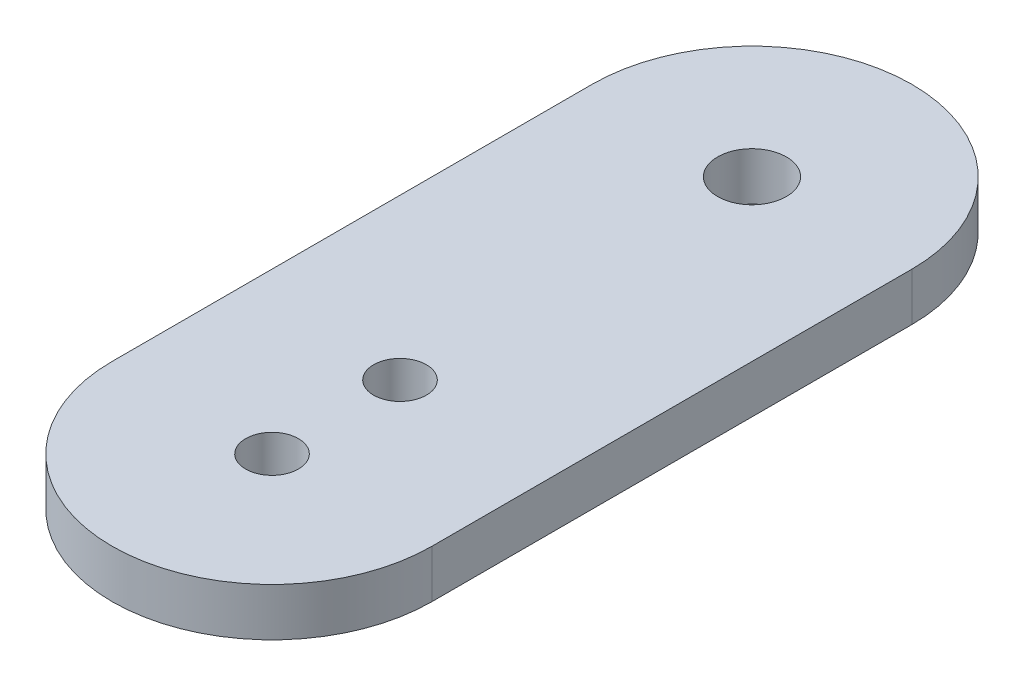
from build123d import *

# Parameters (mm, degrees)
BOSS_EXTRUDE1_DEPTH = 3
SKETCH3_R           = 1.65
SKETCH3_R_2         = 2.15
CUT_EXTRUDE1_DEPTH  = 3
CUT_EXTRUDE2_DEPTH  = 0.1


with BuildPart() as part:
    # Sketch2 → Boss-Extrude1 (new body)
    with BuildSketch(Plane(origin=(0, 0, 0), x_dir=(1, 0, 0), z_dir=(0, 1, 0))):
        with BuildLine():
            Line((-10, 0), (-10, 30))
            ThreePointArc((-10, 30), (0, 40), (10, 30))
            Line((10, 30), (10, 0))
            ThreePointArc((10, 0), (0, -10), (-10, 0))
        make_face()
    extrude(amount=BOSS_EXTRUDE1_DEPTH)

    # Sketch3 → Cut-Extrude1 (cut)
    with BuildSketch(Plane(origin=(0, 3, 0), x_dir=(1, 0, 0), z_dir=(0, 1, 0))):
        Circle(SKETCH3_R)
        with Locations((0, 8)):
            Circle(SKETCH3_R)
        with Locations((0, 30)):
            Circle(SKETCH3_R_2)
    extrude(amount=-CUT_EXTRUDE1_DEPTH, mode=Mode.SUBTRACT)

    # Sketch4 → Cut-Extrude2 (cut)
    # profile 1 of 6: a face of its own
    with BuildSketch(Plane.XZ):
        with BuildLine():
            Line((-3.984014423, -17.192190903), (-4.1671875, -17.365823716))
            add(Edge.make_bspline(
                [(-4.1671875, -17.365823716), (-4.200333744, -17.334642361), (-4.265835839, -17.273023188), (-4.372624862, -17.193073743), (-4.48404262, -17.124584843), (-4.599507729, -17.06885935), (-4.716160781, -17.024396132), (-4.832453395, -16.99274038), (-4.947192703, -16.972552457), (-5.023506471, -16.970138299), (-5.061110276, -16.968948716)],
                knots=[0, 0, 0, 0, 1.08915593, 2.152340314, 3.188132944, 4.216796309, 5.218260357, 6.173443236, 7.099959455, 8, 8, 8, 8], degree=3))
            add(Edge.make_bspline(
                [(-5.061110276, -16.968948716), (-5.084184385, -16.969230116), (-5.130272758, -16.969792185), (-5.198731616, -16.976966017), (-5.266472489, -16.987283541), (-5.333367499, -17.002211854), (-5.399546714, -17.021131946), (-5.464779964, -17.044798485), (-5.529188935, -17.072390535), (-5.59216693, -17.104273754), (-5.653222522, -17.139298435), (-5.710887441, -17.178111817), (-5.765529235, -17.219469904), (-5.816120882, -17.26440816), (-5.862953393, -17.312519524), (-5.907141482, -17.362909023), (-5.947131035, -17.416953341), (-5.983251988, -17.473658133), (-6.015474803, -17.532027462), (-6.043919619, -17.591499514), (-6.067798174, -17.651877029), (-6.086691321, -17.713235771), (-6.102278748, -17.775101048), (-6.113244477, -17.837901224), (-6.119426694, -17.901703542), (-6.120496066, -17.944428105), (-6.121033654, -17.965906348)],
                knots=[0, 0, 0, 0, 1.02818874, 2.053710826, 3.065248034, 4.081641283, 5.106893873, 6.131558223, 7.173050175, 8.228653731, 9.27666206, 10.308777013, 11.325269123, 12.329503258, 13.32196095, 14.316845687, 15.314881793, 16.315733098, 17.311955233, 18.285320748, 19.252783886, 20.203351036, 21.145449891, 22.095197417, 23.042428769, 24, 24, 24, 24], degree=3))
            add(Edge.make_bspline(
                [(-6.121033654, -17.965906348), (-6.120519496, -17.987862029), (-6.119492583, -18.031713437), (-6.112920115, -18.097159762), (-6.100722509, -18.16163408), (-6.084415907, -18.225348256), (-6.064018245, -18.288411409), (-6.038591485, -18.350550135), (-6.008475067, -18.411762133), (-5.973615913, -18.471495869), (-5.935389228, -18.529682068), (-5.892565453, -18.584491315), (-5.847076378, -18.636653465), (-5.797264778, -18.685010368), (-5.744727911, -18.730855483), (-5.68789613, -18.772925723), (-5.627886956, -18.812031442), (-5.564608835, -18.847679788), (-5.498748371, -18.87952631), (-5.43121833, -18.907845425), (-5.361802977, -18.931167617), (-5.290867111, -18.950175506), (-5.218495296, -18.965755887), (-5.144320173, -18.975779235), (-5.068887134, -18.983052818), (-5.018038172, -18.983584633), (-4.992420373, -18.983852562)],
                knots=[0, 0, 0, 0, 0.93586088, 1.869166235, 2.799637598, 3.729985548, 4.670839027, 5.622275134, 6.589130586, 7.576015415, 8.568469353, 9.55398029, 10.53834874, 11.515998671, 12.510579167, 13.508179873, 14.527009472, 15.561807829, 16.601455013, 17.643573243, 18.680854198, 19.719860599, 20.772568776, 21.833555941, 22.908541556, 24, 24, 24, 24], degree=3))
            add(Edge.make_bspline(
                [(-4.992420373, -18.983852562), (-4.96154689, -18.983207191), (-4.900921791, -18.981939901), (-4.811804229, -18.972074526), (-4.726213211, -18.956666618), (-4.644389241, -18.934101963), (-4.566237282, -18.905320356), (-4.491470834, -18.87062528), (-4.420678545, -18.828685985), (-4.3536476, -18.781350907), (-4.291900301, -18.728613137), (-4.236210263, -18.671705035), (-4.187465743, -18.610902832), (-4.144940224, -18.546564645), (-4.109759872, -18.478157928), (-4.080883613, -18.406017917), (-4.058749355, -18.330112163), (-4.049663203, -18.277662321), (-4.045072115, -18.251160254)],
                knots=[0, 0, 0, 0, 1.13008108, 2.219097802, 3.278683437, 4.311054135, 5.322181354, 6.324827112, 7.324222904, 8.330512327, 9.32562643, 10.293043162, 11.24128371, 12.174520618, 13.111833804, 14.052305215, 15.015860969, 16, 16, 16, 16], degree=3))
            Line((-4.045072115, -18.251160254), (-4.838822115, -18.251160254))
            Line((-4.838822115, -18.251160254), (-4.838822115, -18.006929485))
            Line((-4.838822115, -18.006929485), (-3.831370192, -18.006929485))
            add(Edge.make_bspline(
                [(-3.831370192, -18.006929485), (-3.832530778, -18.052450473), (-3.834802255, -18.141543269), (-3.850735482, -18.271471257), (-3.876464216, -18.394188427), (-3.911611678, -18.509824017), (-3.957110753, -18.618214158), (-4.012473134, -18.719468899), (-4.07858488, -18.812934105), (-4.153091091, -18.899372802), (-4.236706956, -18.976477141), (-4.327173106, -19.044244752), (-4.424639008, -19.101328496), (-4.529012466, -19.147770125), (-4.639951797, -19.184015468), (-4.757713712, -19.20971363), (-4.882138515, -19.225110087), (-4.967412219, -19.227077258), (-5.011023888, -19.228083331)],
                knots=[0, 0, 0, 0, 1.140356446, 2.231883559, 3.274166699, 4.278491846, 5.25512956, 6.21435461, 7.1637429, 8.11826594, 9.068280886, 10.0076534, 10.945064095, 11.891975133, 12.864533718, 13.863980011, 14.907571808, 16, 16, 16, 16], degree=3))
            add(Edge.make_bspline(
                [(-5.011023888, -19.228083331), (-5.037904891, -19.227696126), (-5.090922892, -19.226932431), (-5.169225827, -19.221504986), (-5.24536978, -19.213149808), (-5.319343657, -19.200532501), (-5.391419565, -19.185078424), (-5.461237533, -19.165289067), (-5.529063521, -19.142382327), (-5.595002365, -19.116327592), (-5.658455566, -19.086139018), (-5.71970575, -19.052590853), (-5.779091489, -19.015856084), (-5.836208264, -18.975299419), (-5.891353674, -18.93122421), (-5.944172142, -18.883542115), (-5.994959359, -18.832398907), (-6.026773174, -18.796082116), (-6.042803486, -18.77778285)],
                knots=[0, 0, 0, 0, 1.107784379, 2.184907829, 3.233506516, 4.263428166, 5.276301166, 6.270063455, 7.25232949, 8.225834625, 9.190232166, 10.146266622, 11.1027726, 12.066435141, 13.031522626, 14.010570082, 14.99756817, 16, 16, 16, 16], degree=3))
            add(Edge.make_bspline(
                [(-6.042803486, -18.77778285), (-6.066062129, -18.748751567), (-6.112193345, -18.691170889), (-6.171573662, -18.598914498), (-6.222193188, -18.50339109), (-6.263264867, -18.404334745), (-6.295335601, -18.301838116), (-6.318335926, -18.196032177), (-6.331811957, -18.086780678), (-6.333753382, -18.012849489), (-6.334735577, -17.975446612)],
                knots=[0, 0, 0, 0, 1.023165419, 2.029347347, 3.013907458, 3.994755782, 4.975994455, 5.96558838, 6.970761222, 8, 8, 8, 8], degree=3))
            add(Edge.make_bspline(
                [(-6.334735577, -17.975446612), (-6.334373465, -17.947438858), (-6.333653843, -17.891779312), (-6.324927912, -17.809144965), (-6.312408375, -17.727977887), (-6.294006719, -17.648344426), (-6.270809081, -17.570191399), (-6.241857513, -17.493482516), (-6.208149289, -17.418172511), (-6.168970586, -17.344779754), (-6.125370266, -17.274278145), (-6.078051277, -17.206951496), (-6.026341684, -17.1440259), (-5.971085935, -17.08470444), (-5.911624769, -17.029732367), (-5.848515232, -16.978600731), (-5.78170869, -16.931240944), (-5.710994967, -16.888398967), (-5.637429525, -16.849915504), (-5.561188703, -16.816177129), (-5.482295774, -16.788293838), (-5.401341793, -16.764635249), (-5.317713994, -16.747139769), (-5.232019245, -16.734451962), (-5.143810865, -16.725770197), (-5.084187066, -16.725071976), (-5.053955078, -16.724717947)],
                knots=[0, 0, 0, 0, 1.008945113, 2.00506715, 2.99143336, 3.967273523, 4.948097931, 5.927297278, 6.919902385, 7.919676788, 8.923139349, 9.905703106, 10.883022732, 11.856032218, 12.825136022, 13.798837087, 14.781400844, 15.773989409, 16.776158564, 17.77167057, 18.775803737, 19.789618931, 20.80898985, 21.851988756, 22.910860228, 24, 24, 24, 24], degree=3))
            add(Edge.make_bspline(
                [(-5.053955078, -16.724717947), (-5.02930013, -16.725112208), (-4.980412266, -16.725893982), (-4.90766458, -16.731312787), (-4.836041333, -16.739901535), (-4.765436324, -16.751621902), (-4.696089993, -16.767585592), (-4.627804788, -16.786688853), (-4.560481723, -16.808930968), (-4.49433179, -16.835457308), (-4.428910201, -16.865565578), (-4.363853198, -16.899456496), (-4.299383069, -16.937709579), (-4.235388008, -16.980438413), (-4.171464469, -17.026909131), (-4.108623525, -17.078450827), (-4.045348307, -17.133030952), (-4.004661716, -17.172275438), (-3.984014423, -17.192190903)],
                knots=[0, 0, 0, 0, 0.985871117, 1.954866573, 2.915460327, 3.869826059, 4.81536089, 5.759505086, 6.70452669, 7.649098992, 8.607881297, 9.583363685, 10.581137262, 11.603961102, 12.659522466, 13.73993555, 14.853081303, 16, 16, 16, 16], degree=3))
        make_face()
    # profile 2 of 6: a face of its own
    with BuildSketch(Plane.XZ):
        with BuildLine():
            Line((-3.465024038, -17.426881408), (-3.251322115, -17.426881408))
            Line((-3.251322115, -17.426881408), (-3.251322115, -17.683037508))
            add(Edge.make_bspline(
                [(-3.251322115, -17.683037508), (-3.235545478, -17.659187025), (-3.205372781, -17.613573161), (-3.155221663, -17.553246369), (-3.103852432, -17.503297917), (-3.051019171, -17.46349463), (-2.996333356, -17.433686062), (-2.94099518, -17.411851336), (-2.884134012, -17.398939984), (-2.845923846, -17.397216191), (-2.826780349, -17.396352562)],
                knots=[0, 0, 0, 0, 1.2804753, 2.448899062, 3.506932113, 4.484331642, 5.4025378, 6.288909075, 7.142734305, 8, 8, 8, 8], degree=3))
            add(Edge.make_bspline(
                [(-2.826780349, -17.396352562), (-2.811930651, -17.397162545), (-2.781376435, -17.398829138), (-2.735123994, -17.410538646), (-2.687469431, -17.429233515), (-2.656756486, -17.446814095), (-2.640745192, -17.455979215)],
                knots=[0, 0, 0, 0, 0.901110191, 1.854092781, 2.881294221, 4, 4, 4, 4], degree=3))
            Line((-2.640745192, -17.455979215), (-2.758090445, -17.641060344))
            add(Edge.make_bspline(
                [(-2.758090445, -17.641060344), (-2.768369975, -17.636474556), (-2.787882492, -17.627769852), (-2.816426581, -17.617467878), (-2.842743704, -17.611401871), (-2.859510125, -17.6104829), (-2.867326472, -17.610054485)],
                knots=[0, 0, 0, 0, 1.180555205, 2.24091978, 3.179933427, 4, 4, 4, 4], degree=3))
            add(Edge.make_bspline(
                [(-2.867326472, -17.610054485), (-2.884475373, -17.611197511), (-2.91945416, -17.613528951), (-2.970810578, -17.631856961), (-3.020644838, -17.661469669), (-3.060222344, -17.694311265), (-3.090867162, -17.725980392), (-3.112733994, -17.753635823), (-3.132792792, -17.78464557), (-3.151958602, -17.818479516), (-3.169420849, -17.855715357), (-3.185718579, -17.895981079), (-3.200454341, -17.939323319), (-3.208856918, -17.969519283), (-3.213161058, -17.984986877)],
                knots=[0, 0, 0, 0, 1.125678352, 2.296057538, 3.5422874, 4.923748041, 5.663163013, 6.437101912, 7.23742474, 8.08941207, 8.991984279, 9.93940061, 10.944477711, 12, 12, 12, 12], degree=3))
            add(Edge.make_bspline(
                [(-3.213161058, -17.984986877), (-3.216380775, -17.998782597), (-3.223512205, -18.029339068), (-3.230446091, -18.080602975), (-3.237296959, -18.141170857), (-3.242125194, -18.211211307), (-3.246600612, -18.290549416), (-3.249124793, -18.379306051), (-3.251236037, -18.477572313), (-3.251292552, -18.546270935), (-3.251322115, -18.58220743)],
                knots=[0, 0, 0, 0, 0.566838948, 1.255505196, 2.06880316, 3.007127437, 4.065329342, 5.249902469, 6.561414163, 8, 8, 8, 8], degree=3))
            Line((-3.251322115, -18.58220743), (-3.251322115, -19.167025639))
            Line((-3.251322115, -19.167025639), (-3.465024038, -19.167025639))
            Line((-3.465024038, -19.167025639), (-3.465024038, -17.426881408))
        make_face()
    # profile 3 of 6: a face of its own
    with BuildSketch(Plane.XZ):
        with BuildLine():
            add(Edge.make_bspline(
                [(-1.586545974, -17.396352562), (-1.553894768, -17.397047813), (-1.489873734, -17.39841103), (-1.396115155, -17.412980855), (-1.306617482, -17.435260758), (-1.221037948, -17.466061589), (-1.140472575, -17.507346987), (-1.063747854, -17.556611166), (-0.991074139, -17.614973966), (-0.947515614, -17.660121152), (-0.925405649, -17.683037508)],
                knots=[0, 0, 0, 0, 1.054011418, 2.066658804, 3.057071809, 4.030435133, 4.997543892, 5.974964718, 6.972108034, 8, 8, 8, 8], degree=3))
            add(Edge.make_bspline(
                [(-0.925405649, -17.683037508), (-0.906367927, -17.704954523), (-0.868660914, -17.748364399), (-0.820310845, -17.818751165), (-0.778658319, -17.891644697), (-0.745277983, -17.968012968), (-0.718958351, -18.047189306), (-0.700271869, -18.129445853), (-0.689156918, -18.21460095), (-0.687658114, -18.272433919), (-0.686899038, -18.301723656)],
                knots=[0, 0, 0, 0, 1.025258237, 2.030674902, 3.01204498, 3.988269485, 4.97094183, 5.956517959, 6.965070386, 8, 8, 8, 8], degree=3))
            add(Edge.make_bspline(
                [(-0.686899038, -18.301723656), (-0.687566698, -18.331183159), (-0.688886025, -18.389396512), (-0.701366236, -18.475134688), (-0.720777564, -18.558270808), (-0.748557797, -18.638456812), (-0.78418001, -18.715937807), (-0.827648496, -18.790375376), (-0.879268293, -18.861916381), (-0.937781726, -18.929953346), (-1.002450949, -18.992659288), (-1.072606757, -19.0473112), (-1.146870483, -19.094134416), (-1.226229622, -19.131850977), (-1.309959466, -19.161589184), (-1.398240614, -19.18247616), (-1.490935921, -19.195104734), (-1.554227655, -19.196726415), (-1.586545974, -19.197554485)],
                knots=[0, 0, 0, 0, 0.998656419, 1.973391657, 2.932242238, 3.890759089, 4.846373663, 5.82037756, 6.809684879, 7.83454468, 8.860553229, 9.859544525, 10.845671541, 11.83227036, 12.833544569, 13.85385346, 14.904124723, 16, 16, 16, 16], degree=3))
            add(Edge.make_bspline(
                [(-1.586545974, -19.197554485), (-1.619022631, -19.196723636), (-1.682629805, -19.195096375), (-1.775652304, -19.182525223), (-1.864091669, -19.16159881), (-1.947931127, -19.131753248), (-2.02763146, -19.09413321), (-2.102325487, -19.047452757), (-2.172538287, -18.99264308), (-2.237221191, -18.929957737), (-2.295730956, -18.861915249), (-2.347351699, -18.790375669), (-2.390819939, -18.715937731), (-2.426442217, -18.638456833), (-2.454222433, -18.558270803), (-2.473633765, -18.475134689), (-2.486113974, -18.389396512), (-2.487433302, -18.331183159), (-2.488100962, -18.301723656)],
                knots=[0, 0, 0, 0, 1.099876186, 2.154163076, 3.173186993, 4.173200201, 5.163417411, 6.152872554, 7.150605724, 8.17532212, 9.198891216, 10.186952605, 11.159729845, 12.11414092, 13.071450619, 14.029093627, 15.002601286, 16, 16, 16, 16], degree=3))
            add(Edge.make_bspline(
                [(-2.488100962, -18.301723656), (-2.487336709, -18.272593113), (-2.485823621, -18.214919644), (-2.474719846, -18.129924626), (-2.456106257, -18.047807296), (-2.429755075, -17.96893657), (-2.396067061, -17.892902961), (-2.354999828, -17.819829317), (-2.306156558, -17.749760831), (-2.268599516, -17.706407059), (-2.249594351, -17.684468548)],
                knots=[0, 0, 0, 0, 1.031353054, 2.041901799, 3.029428768, 4.008703097, 4.981709435, 5.96992636, 6.972712378, 8, 8, 8, 8], degree=3))
            add(Edge.make_bspline(
                [(-2.249594351, -17.684468548), (-2.22751772, -17.661353455), (-2.184100141, -17.615893558), (-2.111064668, -17.557700894), (-2.034528693, -17.507411566), (-1.953072984, -17.466946498), (-1.867563754, -17.435079577), (-1.777607448, -17.412923397), (-1.683530714, -17.398463525), (-1.6191964, -17.397063229), (-1.586545974, -17.396352562)],
                knots=[0, 0, 0, 0, 1.027980169, 2.021703884, 2.998553061, 3.971491411, 4.943284454, 5.930300938, 6.949603206, 8, 8, 8, 8], degree=3))
        make_face()
        with BuildLine():
            add(Edge.make_bspline(
                [(-1.5875, -17.610054485), (-1.610589696, -17.610710752), (-1.656173032, -17.612006344), (-1.723269571, -17.621860572), (-1.787862783, -17.63747307), (-1.850075214, -17.659655473), (-1.909697069, -17.68829776), (-1.96678543, -17.723477912), (-2.021508215, -17.764729977), (-2.072794941, -17.811989402), (-2.119863621, -17.863614218), (-2.161010244, -17.918619976), (-2.195997683, -17.976114472), (-2.225144291, -18.036157495), (-2.246852574, -18.099357512), (-2.262618505, -18.164998798), (-2.272463437, -18.233215091), (-2.273746848, -18.279588926), (-2.274399038, -18.303154695)],
                knots=[0, 0, 0, 0, 1.021534396, 2.016698045, 2.994645724, 3.958388632, 4.93408049, 5.916473867, 6.921342795, 7.962252576, 8.998418191, 10.008913653, 10.997312074, 11.973003931, 12.956656626, 13.948281152, 14.957379055, 16, 16, 16, 16], degree=3))
            add(Edge.make_bspline(
                [(-2.274399038, -18.303154695), (-2.273305825, -18.333602057), (-2.271135999, -18.394034376), (-2.253490776, -18.483032657), (-2.223972611, -18.568473167), (-2.184112336, -18.64985503), (-2.134169891, -18.725151705), (-2.075327797, -18.792283554), (-2.008217573, -18.850240329), (-1.933639204, -18.898328547), (-1.853115998, -18.936537238), (-1.767896966, -18.963614756), (-1.679014636, -18.981216746), (-1.618271853, -18.982966267), (-1.5875, -18.983852562)],
                knots=[0, 0, 0, 0, 1.016792936, 2.018143844, 3.017858371, 4.030088057, 5.03801393, 6.028138512, 7.003788237, 7.991172063, 8.984598303, 9.972568034, 10.972917682, 12, 12, 12, 12], degree=3))
            add(Edge.make_bspline(
                [(-1.5875, -18.983852562), (-1.556729917, -18.982961103), (-1.495990627, -18.981201389), (-1.407231795, -18.963703406), (-1.322245682, -18.936418594), (-1.241806113, -18.898371519), (-1.167261691, -18.850057716), (-1.099668807, -18.792610824), (-1.041329127, -18.7249739), (-0.991436085, -18.649755295), (-0.950923033, -18.568599334), (-0.921543034, -18.483016888), (-0.90385539, -18.394038392), (-0.901691291, -18.333603402), (-0.900600962, -18.303154695)],
                knots=[0, 0, 0, 0, 1.02726834, 2.027799167, 3.010890988, 4.004497153, 4.992059811, 5.971914811, 6.958719428, 7.966827853, 8.981595046, 9.981490638, 10.983022906, 12, 12, 12, 12], degree=3))
            add(Edge.make_bspline(
                [(-0.900600962, -18.303154695), (-0.901252927, -18.279588786), (-0.902535897, -18.233214673), (-0.912384042, -18.165000396), (-0.928138079, -18.099351649), (-0.949890197, -18.036179126), (-0.97891016, -17.975959011), (-1.0145723, -17.918788786), (-1.055550908, -17.863423672), (-1.103187556, -17.812156284), (-1.154420747, -17.764711554), (-1.209165711, -17.723461916), (-1.266169419, -17.688452373), (-1.325618062, -17.659410484), (-1.38783847, -17.637674883), (-1.452341177, -17.621770425), (-1.519151439, -17.612047988), (-1.564571431, -17.610723236), (-1.5875, -17.610054485)],
                knots=[0, 0, 0, 0, 1.042956736, 2.052379634, 3.044323526, 4.02829302, 5.004299113, 5.996692471, 7.007513377, 8.048758398, 9.090003419, 10.095195979, 11.07790575, 12.047570684, 13.018257071, 13.989683339, 14.985167495, 16, 16, 16, 16], degree=3))
        make_face(mode=Mode.SUBTRACT)
    # profile 4 of 6: a face of its own
    with BuildSketch(Plane.XZ):
        with BuildLine():
            Line((-0.290024038, -17.426881408), (-0.076322115, -17.426881408))
            Line((-0.076322115, -17.426881408), (-0.076322115, -18.233987778))
            add(Edge.make_bspline(
                [(-0.076322115, -18.233987778), (-0.076225569, -18.257679684), (-0.076040881, -18.303001191), (-0.074788384, -18.368216952), (-0.071842374, -18.427691537), (-0.06815904, -18.481459303), (-0.063422301, -18.529511153), (-0.057786657, -18.571679251), (-0.051487624, -18.608441794), (-0.045321742, -18.630582899), (-0.042454177, -18.640880056)],
                knots=[0, 0, 0, 0, 1.388932606, 2.656963016, 3.823490214, 4.879454478, 5.816252168, 6.653371382, 7.373723809, 8, 8, 8, 8], degree=3))
            add(Edge.make_bspline(
                [(-0.042454177, -18.640880056), (-0.037853972, -18.653822402), (-0.028749201, -18.679438026), (-0.012234563, -18.716441974), (0.00819543, -18.750715158), (0.030551849, -18.783579178), (0.056336981, -18.81406053), (0.085224586, -18.842107739), (0.116247672, -18.868780522), (0.162345286, -18.900338747), (0.22538668, -18.934162927), (0.308154001, -18.963347403), (0.397895983, -18.980788917), (0.459920551, -18.982812472), (0.491800631, -18.983852562)],
                knots=[0, 0, 0, 0, 0.725840625, 1.436591201, 2.137033971, 2.831655856, 3.53531722, 4.242432219, 4.957935707, 5.694543706, 7.190802206, 8.724350549, 10.316345118, 12, 12, 12, 12], degree=3))
            add(Edge.make_bspline(
                [(0.491800631, -18.983852562), (0.52367775, -18.982790355), (0.585354076, -18.980735182), (0.674110046, -18.963873525), (0.755243598, -18.935702868), (0.827940406, -18.896373183), (0.891870736, -18.848243315), (0.945145707, -18.791767679), (0.989101714, -18.728733007), (1.008294195, -18.68170381), (1.017946214, -18.658052532)],
                knots=[0, 0, 0, 0, 1.157059328, 2.238695713, 3.266970494, 4.264342957, 5.228770407, 6.160125903, 7.074715775, 8, 8, 8, 8], degree=3))
            add(Edge.make_bspline(
                [(1.017946214, -18.658052532), (1.020799788, -18.648550461), (1.027108344, -18.627543702), (1.033886301, -18.591906766), (1.03999214, -18.549408527), (1.045205837, -18.499770888), (1.048924099, -18.443123568), (1.05092845, -18.37948427), (1.053192866, -18.309052773), (1.053227235, -18.259748816), (1.053245192, -18.233987778)],
                knots=[0, 0, 0, 0, 0.557542046, 1.232589297, 2.036731608, 2.971723315, 4.038036528, 5.22795436, 6.551621927, 8, 8, 8, 8], degree=3))
            Line((1.053245192, -18.233987778), (1.053245192, -17.426881408))
            Line((1.053245192, -17.426881408), (1.266947115, -17.426881408))
            Line((1.266947115, -17.426881408), (1.266947115, -18.274056889))
            add(Edge.make_bspline(
                [(1.266947115, -18.274056889), (1.266646605, -18.302840875), (1.266063574, -18.358685746), (1.262316614, -18.439841543), (1.255887502, -18.515471571), (1.246129354, -18.585615861), (1.234654672, -18.650220862), (1.219852636, -18.709369375), (1.202178157, -18.76287916), (1.18223994, -18.811689191), (1.158684705, -18.85594431), (1.133629179, -18.897946714), (1.104697147, -18.936654229), (1.074237398, -18.973993683), (1.040354486, -19.008107829), (1.003683332, -19.039779458), (0.964740083, -19.069492717), (0.92266054, -19.096088748), (0.878059004, -19.120048644), (0.830880416, -19.141286726), (0.780546915, -19.158093301), (0.727707905, -19.172592165), (0.672104507, -19.183963973), (0.613790325, -19.191983048), (0.552785002, -19.196898853), (0.511208745, -19.197332271), (0.489892578, -19.197554485)],
                knots=[0, 0, 0, 0, 1.493040784, 2.896703357, 4.213163133, 5.428574705, 6.569057535, 7.615249723, 8.588095153, 9.490268104, 10.346124644, 11.18633936, 12.024365274, 12.850166724, 13.684164916, 14.514361689, 15.362232829, 16.222528818, 17.093394965, 17.986930858, 18.902426812, 19.842810585, 20.827885679, 21.843828298, 22.894529745, 24, 24, 24, 24], degree=3))
            add(Edge.make_bspline(
                [(0.489892578, -19.197554485), (0.468735843, -19.197323363), (0.427160888, -19.196869186), (0.366152416, -19.192010206), (0.307676668, -19.183976433), (0.25194154, -19.172508866), (0.198891102, -19.158194784), (0.148310467, -19.14118345), (0.1007919, -19.120037622), (0.055764501, -19.096240391), (0.013580733, -19.069321874), (-0.025953853, -19.039816118), (-0.062786247, -19.007767172), (-0.096924574, -18.97330888), (-0.127889653, -18.936013786), (-0.156067352, -18.896181896), (-0.181891468, -18.854207882), (-0.205263634, -18.809261338), (-0.225342168, -18.759886453), (-0.24306904, -18.705255749), (-0.257567886, -18.644770287), (-0.269366958, -18.578481778), (-0.27885892, -18.506707473), (-0.285448956, -18.429032176), (-0.289133655, -18.345645093), (-0.289720845, -18.288052936), (-0.290024038, -18.258315453)],
                knots=[0, 0, 0, 0, 1.083640291, 2.129454052, 3.13281866, 4.105697902, 5.042300162, 5.946461698, 6.836384745, 7.703652036, 8.553297018, 9.397182691, 10.228592656, 11.052265423, 11.879314572, 12.708807002, 13.549817954, 14.402308542, 15.300838682, 16.27712199, 17.341985831, 18.484375296, 19.725102775, 21.0496083, 22.476576903, 24, 24, 24, 24], degree=3))
            Line((-0.290024038, -18.258315453), (-0.290024038, -17.426881408))
        make_face()
    # profile 5 of 6: a face of its own
    with BuildSketch(Plane.XZ):
        with BuildLine():
            Line((1.755408654, -17.426881408), (1.969110577, -17.426881408))
            Line((1.969110577, -17.426881408), (1.969110577, -17.748865332))
            add(Edge.make_bspline(
                [(1.969110577, -17.748865332), (1.991805579, -17.719652339), (2.035908775, -17.662882731), (2.111921612, -17.589410876), (2.192153959, -17.527447142), (2.278670495, -17.478881526), (2.370126613, -17.442264152), (2.466146993, -17.415199919), (2.567546581, -17.399251345), (2.636872561, -17.397331607), (2.672228065, -17.396352562)],
                knots=[0, 0, 0, 0, 1.0828784, 2.104357462, 3.088488658, 4.04616522, 5.001424249, 5.969181776, 6.964304535, 8, 8, 8, 8], degree=3))
            add(Edge.make_bspline(
                [(2.672228065, -17.396352562), (2.703110566, -17.397245993), (2.764151453, -17.399011905), (2.854001614, -17.410967858), (2.940526295, -17.431458646), (3.023235988, -17.460986768), (3.103016752, -17.497491651), (3.178687502, -17.543563419), (3.251426904, -17.596907631), (3.319405597, -17.65829772), (3.382217098, -17.724719808), (3.436541018, -17.796172483), (3.48339851, -17.870305957), (3.521274194, -17.948269505), (3.550943445, -18.029449196), (3.572044502, -18.11417301), (3.584602292, -18.202126819), (3.586287163, -18.261932063), (3.587139423, -18.292183391)],
                knots=[0, 0, 0, 0, 1.041296284, 2.058176809, 3.050446431, 4.034000596, 5.01514041, 6.003636468, 7.015969324, 8.052561599, 9.08815499, 10.094063707, 11.074456064, 12.040834395, 13.011057502, 13.983766392, 14.980127149, 16, 16, 16, 16], degree=3))
            add(Edge.make_bspline(
                [(3.587139423, -18.292183391), (3.586305655, -18.323073176), (3.584661345, -18.38399229), (3.571908046, -18.473450476), (3.551526673, -18.559507064), (3.52223173, -18.642018916), (3.484375646, -18.720929222), (3.438312365, -18.796181074), (3.383961036, -18.867750361), (3.321843662, -18.934665459), (3.25445229, -18.996305349), (3.182417783, -19.050215535), (3.10685805, -19.095487435), (3.028159665, -19.133303699), (2.945648918, -19.161805346), (2.859710777, -19.182364242), (2.770392031, -19.195042354), (2.709635354, -19.196710687), (2.67890625, -19.197554485)],
                knots=[0, 0, 0, 0, 1.038740735, 2.04854663, 3.033179607, 4.009277356, 4.987731542, 5.972001279, 6.972200261, 8.005528982, 9.039189865, 10.040446548, 11.026516639, 11.997840187, 12.972163198, 13.956796175, 14.96660207, 16, 16, 16, 16], degree=3))
            add(Edge.make_bspline(
                [(2.67890625, -19.197554485), (2.644325348, -19.196673553), (2.576017929, -19.194933455), (2.476143086, -19.177298999), (2.38002437, -19.150944048), (2.288726684, -19.112368483), (2.201526798, -19.063208927), (2.118917965, -19.003262519), (2.040461389, -18.932654629), (1.993238645, -18.879088876), (1.969110577, -18.8517199)],
                knots=[0, 0, 0, 0, 1.014726462, 2.004382257, 2.969841629, 3.936926163, 4.907207904, 5.903978561, 6.929055279, 8, 8, 8, 8], degree=3))
            Line((1.969110577, -18.8517199), (1.969110577, -19.808131408))
            Line((1.969110577, -19.808131408), (1.755408654, -19.808131408))
            Line((1.755408654, -19.808131408), (1.755408654, -17.426881408))
        make_face()
        with BuildLine():
            add(Edge.make_bspline(
                [(2.670320012, -17.610054485), (2.646113203, -17.610490089), (2.598456234, -17.611347682), (2.528602457, -17.621535315), (2.461318246, -17.636324742), (2.397281704, -17.658716589), (2.335879052, -17.68620221), (2.277583219, -17.720548007), (2.222435124, -17.761132675), (2.170573519, -17.8071788), (2.123721886, -17.857916222), (2.082245322, -17.912064356), (2.047406066, -17.96955463), (2.018489513, -18.029851528), (1.99648453, -18.093427695), (1.980866442, -18.159921049), (1.971048648, -18.229404367), (1.969763496, -18.276727293), (1.969110577, -18.300769629)],
                knots=[0, 0, 0, 0, 1.05670511, 2.080379991, 3.077984906, 4.06214886, 5.038337365, 6.01289324, 7.01187578, 8.025460281, 9.038092164, 10.024533457, 11.000252242, 11.969694649, 12.940728589, 13.933144304, 14.949937299, 16, 16, 16, 16], degree=3))
            add(Edge.make_bspline(
                [(1.969110577, -18.300769629), (1.970192927, -18.332330113), (1.972313343, -18.394159774), (1.989551802, -18.484500399), (2.017606509, -18.569988401), (2.057426937, -18.649903856), (2.107737698, -18.723370749), (2.168356265, -18.789154894), (2.238734143, -18.846842778), (2.317701286, -18.895434739), (2.402352771, -18.934887334), (2.490653544, -18.963131823), (2.581389293, -18.980530071), (2.642735953, -18.982739068), (2.673659105, -18.983852562)],
                knots=[0, 0, 0, 0, 1.03728447, 2.032128127, 3.01272805, 3.987917167, 4.958271349, 5.931593992, 6.91984656, 7.941419022, 8.973179163, 9.983609215, 10.983593296, 12, 12, 12, 12], degree=3))
            add(Edge.make_bspline(
                [(2.673659105, -18.983852562), (2.703959332, -18.98279367), (2.764099837, -18.980691959), (2.852653845, -18.962500442), (2.938712654, -18.934711238), (3.020478093, -18.894189469), (3.097238359, -18.844530161), (3.166554202, -18.784958067), (3.227110691, -18.715908659), (3.278725547, -18.639022517), (3.32031679, -18.55657998), (3.351565756, -18.471275856), (3.369601054, -18.383410845), (3.372157012, -18.32422133), (3.3734375, -18.294568457)],
                knots=[0, 0, 0, 0, 1.00104056, 1.986885549, 2.97790532, 3.984399681, 4.995088187, 5.994304198, 6.996462723, 8.023150851, 9.048424203, 10.043036403, 11.019596776, 12, 12, 12, 12], degree=3))
            add(Edge.make_bspline(
                [(3.3734375, -18.294568457), (3.372447761, -18.264731402), (3.370475995, -18.205289753), (3.351053814, -18.117684992), (3.321866508, -18.032036208), (3.27930401, -17.950719549), (3.228820647, -17.873992896), (3.167760636, -17.806260703), (3.099305688, -17.746953513), (3.022636811, -17.697957315), (2.940354128, -17.658982719), (2.853734516, -17.630486886), (2.763217351, -17.613359746), (2.701558179, -17.61116593), (2.670320012, -17.610054485)],
                knots=[0, 0, 0, 0, 0.983928682, 1.960191568, 2.949917689, 3.96440592, 4.982380491, 5.975291189, 6.965713506, 7.964880129, 8.970154049, 9.96478489, 10.968906225, 12, 12, 12, 12], degree=3))
        make_face(mode=Mode.SUBTRACT)
    # profile 6 of 6: a face of its own
    with BuildSketch(Plane.XZ):
        with BuildLine():
            Line((5.083052885, -17.33529487), (4.869350962, -17.33529487))
            add(Edge.make_bspline(
                [(4.869350962, -17.33529487), (4.875140495, -17.311324198), (4.88645856, -17.264463494), (4.910065302, -17.197511411), (4.935782295, -17.134154158), (4.966663096, -17.07557808), (5.000346731, -17.020605969), (5.03893844, -16.970484654), (5.080657751, -16.923939404), (5.12680294, -16.882632719), (5.175195833, -16.845228229), (5.226518315, -16.813336449), (5.27973782, -16.785901623), (5.335223076, -16.763300001), (5.393139275, -16.746273707), (5.452962822, -16.733920595), (5.514850489, -16.725898426), (5.556860904, -16.725115496), (5.578192608, -16.724717947)],
                knots=[0, 0, 0, 0, 1.162005537, 2.271625781, 3.343758855, 4.383309926, 5.390229558, 6.379919256, 7.361854164, 8.333198761, 9.295911338, 10.242430842, 11.177959212, 12.116337295, 13.062827104, 14.020064771, 14.994644689, 16, 16, 16, 16], degree=3))
            add(Edge.make_bspline(
                [(5.578192608, -16.724717947), (5.609273188, -16.725656316), (5.67075639, -16.727512586), (5.761082677, -16.7444633), (5.848186638, -16.771286471), (5.931114859, -16.80834806), (6.008143828, -16.854059429), (6.076680412, -16.908464008), (6.135795631, -16.970512105), (6.185389842, -17.039046224), (6.224221225, -17.112290419), (6.25285499, -17.187674097), (6.270286883, -17.265018439), (6.272546048, -17.317240802), (6.273677885, -17.343404094)],
                knots=[0, 0, 0, 0, 1.083050992, 2.142477498, 3.193116406, 4.255571735, 5.30263384, 6.308962982, 7.297363603, 8.282367274, 9.249857812, 10.179914175, 11.08814088, 12, 12, 12, 12], degree=3))
            add(Edge.make_bspline(
                [(6.273677885, -17.343404094), (6.272886227, -17.368581932), (6.271337076, -17.417851052), (6.258183252, -17.489779427), (6.236046973, -17.557571302), (6.205383438, -17.621512057), (6.165690347, -17.681196278), (6.117607673, -17.73675825), (6.060796041, -17.78844441), (6.017743763, -17.818053194), (5.995579177, -17.833296673)],
                knots=[0, 0, 0, 0, 1.024540389, 2.004866551, 2.965041327, 3.920577974, 4.882998113, 5.874504559, 6.905732034, 8, 8, 8, 8], degree=3))
            add(Edge.make_bspline(
                [(5.995579177, -17.833296673), (6.020910067, -17.84552825), (6.071097887, -17.869762543), (6.139508158, -17.917289406), (6.201609712, -17.972164528), (6.236242421, -18.014988012), (6.253643329, -18.036504305)],
                knots=[0, 0, 0, 0, 1.015518401, 2.012035669, 3.001164323, 4, 4, 4, 4], degree=3))
            add(Edge.make_bspline(
                [(6.253643329, -18.036504305), (6.265101457, -18.052191811), (6.287830077, -18.083309929), (6.315884967, -18.133340962), (6.341336525, -18.183926528), (6.361169085, -18.236422481), (6.376527377, -18.290220371), (6.387505642, -18.345412573), (6.394325637, -18.402044156), (6.395302325, -18.440356754), (6.395793269, -18.459615032)],
                knots=[0, 0, 0, 0, 1.025084078, 2.033381695, 3.024893161, 4.013698104, 4.991890475, 5.976764909, 6.982997093, 8, 8, 8, 8], degree=3))
            add(Edge.make_bspline(
                [(6.395793269, -18.459615032), (6.394572359, -18.492959146), (6.392136285, -18.559490456), (6.370362084, -18.657784864), (6.336607361, -18.753868644), (6.288671482, -18.845767775), (6.230250909, -18.93175157), (6.160747444, -19.008683845), (6.080950798, -19.07481361), (5.99195624, -19.130065568), (5.89553798, -19.17423294), (5.792412443, -19.204888093), (5.684065531, -19.224853854), (5.609765566, -19.226994849), (5.571991436, -19.228083331)],
                knots=[0, 0, 0, 0, 0.955779014, 1.907060117, 2.875433937, 3.871313158, 4.872415639, 5.851225146, 6.836215519, 7.83643374, 8.849228613, 9.86973379, 10.916971861, 12, 12, 12, 12], degree=3))
            add(Edge.make_bspline(
                [(5.571991436, -19.228083331), (5.546532948, -19.227492636), (5.496439133, -19.226330345), (5.422794895, -19.218384725), (5.352499239, -19.203872704), (5.28545712, -19.184344205), (5.221608979, -19.159584824), (5.16114965, -19.128751924), (5.103707169, -19.092481062), (5.049823597, -19.050344104), (4.999505357, -19.003208049), (4.954089665, -18.950236116), (4.912819341, -18.892407525), (4.876799439, -18.829050588), (4.844389298, -18.760984083), (4.817732254, -18.687336444), (4.794269751, -18.608766065), (4.783361269, -18.554012459), (4.777764423, -18.52591987)],
                knots=[0, 0, 0, 0, 1.048658725, 2.063410685, 3.046034179, 4.001477787, 4.936774919, 5.862367409, 6.792675028, 7.730719943, 8.675894397, 9.627829632, 10.600096036, 11.597688215, 12.626045268, 13.701542398, 14.82072376, 16, 16, 16, 16], degree=3))
            Line((4.777764423, -18.52591987), (4.991466346, -18.52591987))
            add(Edge.make_bspline(
                [(4.991466346, -18.52591987), (4.997033907, -18.544254823), (5.007863296, -18.579917901), (5.026297095, -18.631244252), (5.047298545, -18.678296427), (5.069828271, -18.721419587), (5.093490036, -18.761038418), (5.119966083, -18.796105297), (5.147295448, -18.828160461), (5.167896222, -18.846220277), (5.177978516, -18.855058992)],
                knots=[0, 0, 0, 0, 1.198163088, 2.33053128, 3.407730985, 4.417276592, 5.372219308, 6.28897303, 7.162600585, 8, 8, 8, 8], degree=3))
            add(Edge.make_bspline(
                [(5.177978516, -18.855058992), (5.191311186, -18.865338055), (5.217935373, -18.885864452), (5.261320545, -18.91205931), (5.306948619, -18.934756722), (5.355808246, -18.952094736), (5.40684508, -18.966775252), (5.460884056, -18.976382248), (5.517448416, -18.982973664), (5.556070769, -18.983555323), (5.575807542, -18.983852562)],
                knots=[0, 0, 0, 0, 0.946170439, 1.889420265, 2.845303464, 3.807233317, 4.801018734, 5.828864929, 6.890507805, 8, 8, 8, 8], degree=3))
            add(Edge.make_bspline(
                [(5.575807542, -18.983852562), (5.598091622, -18.983433526), (5.641666215, -18.982614139), (5.705248896, -18.975078702), (5.765737713, -18.96410426), (5.822461079, -18.947154535), (5.876162013, -18.926212562), (5.926087743, -18.899917844), (5.972893665, -18.869067238), (6.015980278, -18.834002204), (6.054723561, -18.795615437), (6.088836337, -18.755465472), (6.11783633, -18.713721595), (6.141229443, -18.670152802), (6.159701514, -18.624939513), (6.172276691, -18.577954845), (6.181020312, -18.529583312), (6.181732382, -18.496702353), (6.182091346, -18.4801266)],
                knots=[0, 0, 0, 0, 1.217147791, 2.380027433, 3.494444702, 4.572153297, 5.609568379, 6.639424714, 7.649109417, 8.668170816, 9.669597737, 10.625200337, 11.543417969, 12.441394052, 13.322311151, 14.205496177, 15.095365482, 16, 16, 16, 16], degree=3))
            add(Edge.make_bspline(
                [(6.182091346, -18.4801266), (6.181050195, -18.457939243), (6.178973072, -18.41367493), (6.163114914, -18.348552794), (6.137030793, -18.285807937), (6.100514317, -18.226510873), (6.056062687, -18.171554411), (6.004107277, -18.122520063), (5.944216644, -18.082059162), (5.889094197, -18.054104201), (5.84026826, -18.035028977), (5.798483865, -18.022323331), (5.751704818, -18.011564398), (5.70049682, -18.001554799), (5.644474025, -17.99303581), (5.583697423, -17.985931646), (5.5181547, -17.980247234), (5.472780889, -17.977708757), (5.449399038, -17.976400639)],
                knots=[0, 0, 0, 0, 1.07054697, 2.135767047, 3.216561865, 4.33974944, 5.486079747, 6.621378074, 7.775625952, 8.963672916, 9.598146892, 10.304877434, 11.070270905, 11.915000392, 12.823868403, 13.805723172, 14.86925407, 16, 16, 16, 16], degree=3))
            Line((5.449399038, -17.976400639), (5.449399038, -17.73216987))
            add(Edge.make_bspline(
                [(5.449399038, -17.73216987), (5.478859296, -17.731669941), (5.536564703, -17.730690703), (5.620857078, -17.718847038), (5.701461242, -17.702463611), (5.776590865, -17.677368507), (5.845067936, -17.648221805), (5.904476451, -17.614304498), (5.9539841, -17.576602678), (5.993350293, -17.53453442), (6.022965714, -17.489416504), (6.044619303, -17.442392492), (6.05741024, -17.39305023), (6.059117709, -17.359376179), (6.059975962, -17.342450068)],
                knots=[0, 0, 0, 0, 1.321986639, 2.589447074, 3.816329219, 5.01088745, 6.139805852, 7.153945165, 8.075214402, 8.924034688, 9.728124013, 10.488707548, 11.240355623, 12, 12, 12, 12], degree=3))
            add(Edge.make_bspline(
                [(6.059975962, -17.342450068), (6.059694014, -17.330014674), (6.059133093, -17.305275046), (6.052059231, -17.269131026), (6.041429303, -17.23409199), (6.026815416, -17.200306944), (6.007255013, -17.168010204), (5.983846654, -17.136926422), (5.955973714, -17.107233065), (5.924034044, -17.079555919), (5.889736012, -17.053178991), (5.852146433, -17.030785963), (5.812398694, -17.011637269), (5.770448787, -16.995846519), (5.726160578, -16.983967967), (5.679742152, -16.975439118), (5.631104996, -16.970106714), (5.5979228, -16.969338988), (5.581054687, -16.968948716)],
                knots=[0, 0, 0, 0, 0.884392785, 1.759457502, 2.611959086, 3.489218968, 4.37281399, 5.2945488, 6.255912374, 7.266815255, 8.301784654, 9.332968512, 10.37626691, 11.440494194, 12.520033166, 13.637162961, 14.798855837, 16, 16, 16, 16], degree=3))
            add(Edge.make_bspline(
                [(5.581054687, -16.968948716), (5.553941321, -16.969895339), (5.500982609, -16.971744314), (5.424636388, -16.987938864), (5.353661984, -17.013777525), (5.299411213, -17.044620168), (5.259350033, -17.075066445), (5.230722688, -17.101656426), (5.202609983, -17.131206258), (5.176861407, -17.165535974), (5.150821433, -17.202320701), (5.127114687, -17.243430384), (5.104078004, -17.28779266), (5.090196983, -17.319154154), (5.083052885, -17.33529487)],
                knots=[0, 0, 0, 0, 1.472543308, 2.876219568, 4.221790263, 5.565193594, 6.249813518, 6.953379497, 7.687249741, 8.463570142, 9.283606569, 10.136032583, 11.040678096, 12, 12, 12, 12], degree=3))
        make_face()
    extrude(amount=-CUT_EXTRUDE2_DEPTH, mode=Mode.SUBTRACT)


solid = part.part
